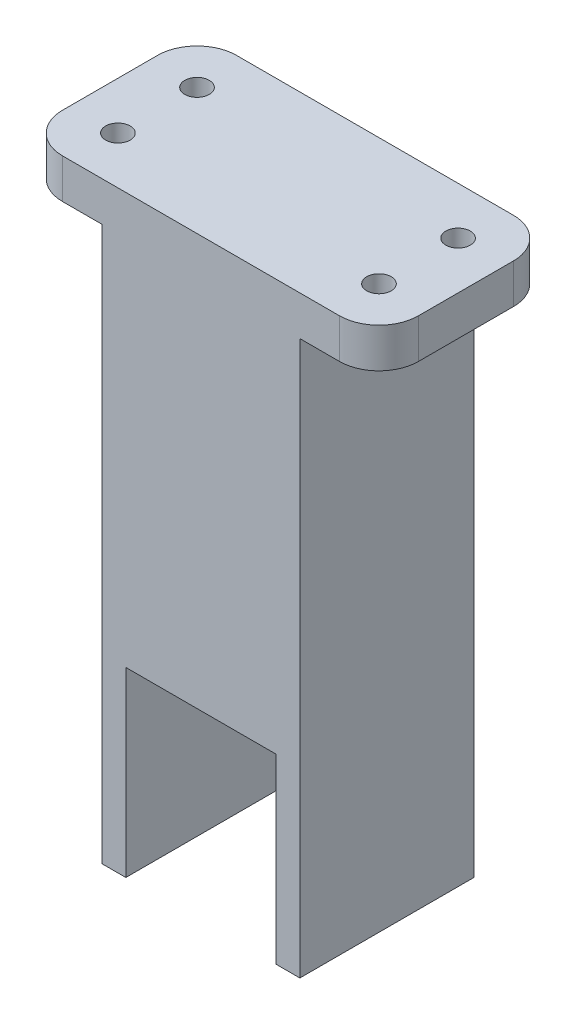
from build123d import *

# Parameters (mm, degrees)
CROQUIS1_R              = 10
CROQUIS1_R_2            = 3.5
EXTRUIR1_DEPTH          = 12
CROQUIS2_W              = 45
CROQUIS2_H              = 22
SALIENTE_EXTRUIR1_DEPTH = 5
REDONDEO1_R             = 5
REDONDEO2_R             = 5
REDONDEO3_R             = 5
REDONDEO4_R             = 5
CROQUIS3_R              = 4.1
CORTAR_EXTRUIR1_DEPTH   = 45
CROQUIS4_R              = 1.55
CORTAR_EXTRUIR2_DEPTH   = 45
CROQUIS7_W              = 22.113905464
CROQUIS7_H              = 24
CORTAR_EXTRUIR4_DEPTH   = 70
CROQUIS8_W              = 45
CROQUIS8_H              = 22
SALIENTE_EXTRUIR2_DEPTH = 5
REDONDEO5_R             = 5
REDONDEO6_R             = 5
REDONDEO7_R             = 5
REDONDEO8_R             = 5
CORTAR_EXTRUIR5_START   = -15
CROQUIS9_R              = 1.55
CROQUIS9_R_2            = 4.1
CORTAR_EXTRUIR5_DEPTH   = 15
CROQUIS10_W             = 11.329180456
CROQUIS10_H             = 11.81266377
SALIENTE_EXTRUIR3_DEPTH = 10
CROQUIS11_W             = 64.145296703
CROQUIS11_H             = 8.366265536
CORTAR_EXTRUIR8_DEPTH   = 30
CROQUIS12_W             = 25
CROQUIS12_H             = 22
SALIENTE_EXTRUIR4_DEPTH = 70
CROQUIS13_W             = 19
CROQUIS13_H             = 16
CORTAR_EXTRUIR9_DEPTH   = 70
CROQUIS14_W             = 19
CROQUIS14_H             = 23
CORTAR_EXTRUIR10_DEPTH  = 70
CROQUIS15_W             = 16.823011057
CROQUIS15_H             = 23
CROQUIS15_W_2           = 14.386150498
CORTAR_EXTRUIR11_DEPTH  = 70
REDONDEO9_R             = 5
REDONDEO10_R            = 5
REDONDEO11_R            = 5
REDONDEO12_R            = 5
CROQUIS16_W             = 3
CROQUIS16_H             = 16
SALIENTE_EXTRUIR5_DEPTH = 47
CROQUIS17_W             = 22
CROQUIS17_H             = 23
SALIENTE_EXTRUIR6_DEPTH = 3
CROQUIS18_W             = 22
CROQUIS18_H             = 23
SALIENTE_EXTRUIR7_DEPTH = 3


with BuildPart() as part:
    # Croquis1 → Extruir1 (new body)
    with BuildSketch(Plane(origin=(0, 0, 0), x_dir=(1, 0, 0), z_dir=(0, 1, 0))):
        with Locations(Location((0, 0, 0), (0, 0, 270))):
            Circle(CROQUIS1_R)
        with Locations(Location((0, 0, 0), (0, 0, 270))):
            Circle(CROQUIS1_R_2, mode=Mode.SUBTRACT)
    extrude(amount=EXTRUIR1_DEPTH)

    # Croquis2 → Saliente-Extruir1 (add)
    with BuildSketch(Plane(origin=(0, 12, 0), x_dir=(1, 0, 0), z_dir=(0, 1, 0))):
        Rectangle(CROQUIS2_W, CROQUIS2_H)
    extrude(amount=SALIENTE_EXTRUIR1_DEPTH)

    # Redondeo1
    redondeo1_edges = [part.edges().sort_by_distance(p)[0] for p in [
        (22.5, 14.5, -11),
    ]]
    fillet(redondeo1_edges, radius=REDONDEO1_R)

    # Redondeo2
    redondeo2_edges = [part.edges().sort_by_distance(p)[0] for p in [
        (22.5, 14.5, 11),
    ]]
    fillet(redondeo2_edges, radius=REDONDEO2_R)

    # Redondeo3
    redondeo3_edges = [part.edges().sort_by_distance(p)[0] for p in [
        (-22.5, 14.5, 11),
    ]]
    fillet(redondeo3_edges, radius=REDONDEO3_R)

    # Redondeo4
    redondeo4_edges = [part.edges().sort_by_distance(p)[0] for p in [
        (-22.5, 14.5, -11),
    ]]
    fillet(redondeo4_edges, radius=REDONDEO4_R)

    # Croquis3 → Cortar-Extruir1 (cut)
    with BuildSketch(Plane.XZ):
        with Locations(Location((0, 0, 0), (0, 0, 270))):
            Circle(CROQUIS3_R)
    extrude(amount=-CORTAR_EXTRUIR1_DEPTH, mode=Mode.SUBTRACT)

    # Croquis4 → Cortar-Extruir2 (cut)
    with BuildSketch(Plane.XZ.offset(-12)):
        with Locations(Location((-16.5, 5, 0), (0, 0, 270))):
            Circle(CROQUIS4_R)
        with Locations(Location((-16.5, -5, 0), (0, 0, 270))):
            Circle(CROQUIS4_R)
        with Locations(Location((16.5, 5, 0), (0, 0, 270))):
            Circle(CROQUIS4_R)
        with Locations(Location((16.5, -5, 0), (0, 0, 270))):
            Circle(CROQUIS4_R)
    extrude(amount=-CORTAR_EXTRUIR2_DEPTH, mode=Mode.SUBTRACT)

    # Croquis7 → Cortar-Extruir4 (cut)
    with BuildSketch(Plane.XY.offset(11)):
        Rectangle(CROQUIS7_W, CROQUIS7_H)
    extrude(amount=-CORTAR_EXTRUIR4_DEPTH, mode=Mode.SUBTRACT)

    # Croquis8 → Saliente-Extruir2 (add)
    with BuildSketch(Plane.XZ.offset(-12)):
        Rectangle(CROQUIS8_W, CROQUIS8_H)
    extrude(amount=SALIENTE_EXTRUIR2_DEPTH)

    # Redondeo5
    redondeo5_edges = [part.edges().sort_by_distance(p)[0] for p in [
        (-22.5, 9.5, -11),
    ]]
    fillet(redondeo5_edges, radius=REDONDEO5_R)

    # Redondeo6
    redondeo6_edges = [part.edges().sort_by_distance(p)[0] for p in [
        (22.5, 9.5, -11),
    ]]
    fillet(redondeo6_edges, radius=REDONDEO6_R)

    # Redondeo7
    redondeo7_edges = [part.edges().sort_by_distance(p)[0] for p in [
        (22.5, 9.5, 11),
    ]]
    fillet(redondeo7_edges, radius=REDONDEO7_R)

    # Redondeo8
    redondeo8_edges = [part.edges().sort_by_distance(p)[0] for p in [
        (-22.5, 9.5, 11),
    ]]
    fillet(redondeo8_edges, radius=REDONDEO8_R)

    # Croquis9 → Cortar-Extruir5 (cut)
    with BuildSketch(Plane(origin=(0, 17, 0), x_dir=(1, 0, 0), z_dir=(0, 1, 0)).offset(CORTAR_EXTRUIR5_START)):
        with Locations(Location((-16.5, -5, 0), (0, 0, 90))):
            Circle(CROQUIS9_R)
        with Locations(Location((-16.5, 5, 0), (0, 0, 90))):
            Circle(CROQUIS9_R)
        with Locations(Location((16.5, -5, 0), (0, 0, 90))):
            Circle(CROQUIS9_R)
        with Locations(Location((16.5, 5, 0), (0, 0, 90))):
            Circle(CROQUIS9_R)
        with Locations(Location((0, 0, 0), (0, 0, 90))):
            Circle(CROQUIS9_R_2)
    extrude(amount=CORTAR_EXTRUIR5_DEPTH, mode=Mode.SUBTRACT)

    # Croquis10 → Saliente-Extruir3 (add)
    with BuildSketch(Plane(origin=(0, 17, 0), x_dir=(1, 0, 0), z_dir=(0, 1, 0))):
        Rectangle(CROQUIS10_W, CROQUIS10_H)
    extrude(amount=-SALIENTE_EXTRUIR3_DEPTH)

    # Croquis11 → Cortar-Extruir8 (cut)
    with BuildSketch(Plane(origin=(0, 0, -11), x_dir=(-1, 0, 0), z_dir=(0, 0, -1))):
        with Locations((-4.603378936, 7.816867232)):
            Rectangle(CROQUIS11_W, CROQUIS11_H)
    extrude(amount=-CORTAR_EXTRUIR8_DEPTH, mode=Mode.SUBTRACT)

    # Croquis12 → Saliente-Extruir4 (add)
    with BuildSketch(Plane.XZ.offset(-12)):
        Rectangle(CROQUIS12_W, CROQUIS12_H)
    extrude(amount=SALIENTE_EXTRUIR4_DEPTH)

    # Croquis13 → Cortar-Extruir9 (cut)
    with BuildSketch(Plane.XZ.offset(58)):
        Rectangle(CROQUIS13_W, CROQUIS13_H)
    extrude(amount=-CORTAR_EXTRUIR9_DEPTH, mode=Mode.SUBTRACT)

    # Croquis14 → Cortar-Extruir10 (cut)
    with BuildSketch(Plane.XY.offset(11)):
        with Locations((0, -46.5)):
            Rectangle(CROQUIS14_W, CROQUIS14_H)
    extrude(amount=-CORTAR_EXTRUIR10_DEPTH, mode=Mode.SUBTRACT)

    # Croquis15 → Cortar-Extruir11 (cut)
    with BuildSketch(Plane(origin=(12.5, 0, 0), x_dir=(0, 0, -1), z_dir=(1, 0, 0))):
        with Locations((-16.411505529, -46.5)):
            Rectangle(CROQUIS15_W, CROQUIS15_H)
        with Locations((15.193075249, -46.5)):
            Rectangle(CROQUIS15_W_2, CROQUIS15_H)
    extrude(amount=-CORTAR_EXTRUIR11_DEPTH, mode=Mode.SUBTRACT)

    # Redondeo9
    # the kernel refuses this fillet: 5 mm, written as the material it adds along each edge
    with BuildSketch(Plane(origin=(-9.5, -35, -8), x_dir=(0, 0, -1), z_dir=(-1, 0, 0))) as redondeo9_piece_1:
        with BuildLine():
            CenterArc((5, 4.582575695), REDONDEO9_R, 180, 66.421821522)
            Line((0, 4.582575695), (0, 0))
            Line((0, 0), (3, 0))
        make_face()
    extrude(amount=3)

    # Redondeo10
    # the kernel refuses this fillet: 5 mm, written as the material it adds along each edge
    with BuildSketch(Plane(origin=(12.5, -35, -8), x_dir=(0, 0, -1), z_dir=(-1, 0, 0))) as redondeo10_piece_1:
        with BuildLine():
            CenterArc((5, 4.582575695), REDONDEO10_R, 180, 66.421821522)
            Line((0, 4.582575695), (0, 0))
            Line((0, 0), (3, 0))
        make_face()
    extrude(amount=3)

    # Redondeo11
    # the kernel refuses this fillet: 5 mm, written as the material it adds along each edge
    with BuildSketch(Plane(origin=(-9.5, -35, 8), x_dir=(0, 0, 1), z_dir=(-1, 0, 0))) as redondeo11_piece_1:
        with BuildLine():
            CenterArc((5, -4.582575695), REDONDEO11_R, 113.578178478, 66.421821522)
            Line((0, -4.582575695), (0, 0))
            Line((0, 0), (3, 0))
        make_face()
    extrude(amount=3)

    # Redondeo12
    # the kernel refuses this fillet: 5 mm, written as the material it adds along each edge
    with BuildSketch(Plane(origin=(12.5, -35, 8), x_dir=(0, 0, 1), z_dir=(-1, 0, 0))) as redondeo12_piece_1:
        with BuildLine():
            CenterArc((5, -4.582575695), REDONDEO12_R, 113.578178478, 66.421821522)
            Line((0, -4.582575695), (0, 0))
            Line((0, 0), (3, 0))
        make_face()
    extrude(amount=3)

    # Croquis16 → Saliente-Extruir5 (add)
    with BuildSketch(Plane.XZ.offset(-12)):
        Rectangle(CROQUIS16_W, CROQUIS16_H)
    extrude(amount=SALIENTE_EXTRUIR5_DEPTH)

    # Croquis17 → Saliente-Extruir6 (add)
    with BuildSketch(Plane(origin=(12.5, 0, 0), x_dir=(0, 0, -1), z_dir=(1, 0, 0))):
        with Locations((0, -46.5)):
            Rectangle(CROQUIS17_W, CROQUIS17_H)
    extrude(amount=-SALIENTE_EXTRUIR6_DEPTH)

    # Croquis18 → Saliente-Extruir7 (add)
    with BuildSketch(Plane.ZY.offset(12.5)):
        with Locations((0, -46.5)):
            Rectangle(CROQUIS18_W, CROQUIS18_H)
    extrude(amount=-SALIENTE_EXTRUIR7_DEPTH)


solid = part.part
